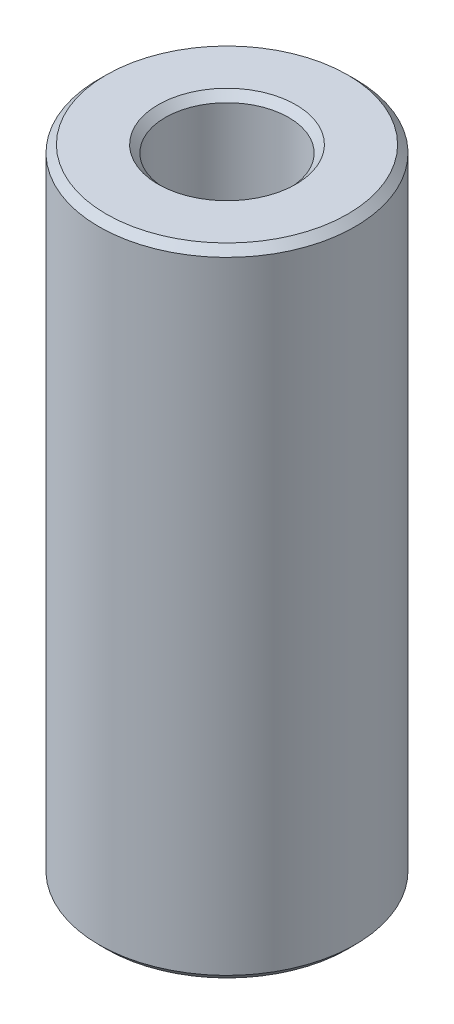
from build123d import *
from OCP.BRepFilletAPI import BRepFilletAPI_MakeChamfer

# Parameters (mm, degrees)
SKETCH1_R           = 42.5
BOSS_EXTRUDE1_DEPTH = 211.299643376
SKETCH2_R           = 20.469178735
CUT_EXTRUDE1_DEPTH  = 220.681677185
CHAMFER1_SIZE       = 2.409146421
CHAMFER1_SIZE2      = 2.447162202


with BuildPart() as part:
    # Sketch1 → Boss-Extrude1 (new body)
    with BuildSketch(Plane(origin=(0, 0, 0), x_dir=(1, 0, 0), z_dir=(0, 1, 0))):
        Circle(SKETCH1_R)
    extrude(amount=BOSS_EXTRUDE1_DEPTH)

    # Sketch2 → Cut-Extrude1 (cut, through all)
    with BuildSketch(Plane(origin=(0, 0, 0), x_dir=(1, 0, 0), z_dir=(0, 1, 0))):
        Circle(SKETCH2_R)
    extrude(amount=CUT_EXTRUDE1_DEPTH, mode=Mode.SUBTRACT)

    # Chamfer1: one chamfer whose edges measure the first distance from different faces: ONE call of the kernel's chamfer builder (chamfer() names one face for all edges)
    chamfer1_edges_1 = [part.edges().sort_by_distance(p)[0] for p in [
        (-20.469178735, 211.299643376, 0),
    ]]
    chamfer1_side_1 = [part.faces().sort_by_distance(p)[0] for p in [
        (-41.297918472, 211.299643376, 0),
    ]]
    chamfer1_edges_2 = [part.edges().sort_by_distance(p)[0] for p in [
        (-20.469178735, 0, 0),
    ]]
    chamfer1_side_2 = [part.faces().sort_by_distance(p)[0] for p in [
        (-20.469178735, 105.649821688, 0),
    ]]
    chamfer1_edges_3 = [part.edges().sort_by_distance(p)[0] for p in [
        (-42.5, 0, 0),
    ]]
    chamfer1_side_3 = [part.faces().sort_by_distance(p)[0] for p in [
        (-41.297918472, 0, 0),
    ]]
    chamfer1_edges_4 = [part.edges().sort_by_distance(p)[0] for p in [
        (-42.5, 211.299643376, 0),
    ]]
    chamfer1_side_4 = [part.faces().sort_by_distance(p)[0] for p in [
        (-42.5, 105.649821688, 0),
    ]]
    chamfer1 = BRepFilletAPI_MakeChamfer(part.part.solid().wrapped)
    for e in chamfer1_edges_1:
        chamfer1.Add(CHAMFER1_SIZE, CHAMFER1_SIZE2, e.wrapped, chamfer1_side_1[0].wrapped)  # the first distance lies on this face
    for e in chamfer1_edges_2:
        chamfer1.Add(CHAMFER1_SIZE, CHAMFER1_SIZE2, e.wrapped, chamfer1_side_2[0].wrapped)  # the first distance lies on this face
    for e in chamfer1_edges_3:
        chamfer1.Add(CHAMFER1_SIZE, CHAMFER1_SIZE2, e.wrapped, chamfer1_side_3[0].wrapped)  # the first distance lies on this face
    for e in chamfer1_edges_4:
        chamfer1.Add(CHAMFER1_SIZE, CHAMFER1_SIZE2, e.wrapped, chamfer1_side_4[0].wrapped)  # the first distance lies on this face
    add(Compound.cast(chamfer1.Shape()), mode=Mode.REPLACE)


solid = part.part
